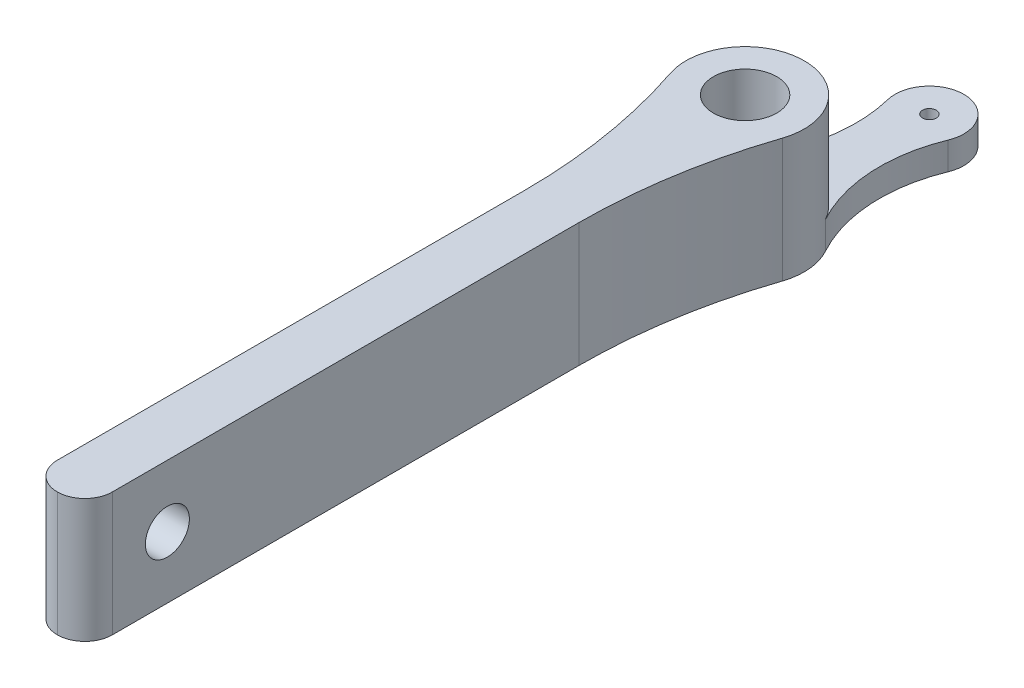
from build123d import *

# Parameters (mm, degrees)
SKETCH1_R           = 14.605
BOSS_EXTRUDE1_DEPTH = 57.15
FILLET1_R           = 254
SKETCH2_R           = 10.16
CUT_EXTRUDE1_DEPTH  = 313.681247479
SKETCH8_R           = 3.175
BOSS_EXTRUDE6_DEPTH = 12.7
SKETCH9_W           = 25.4
SKETCH9_H           = 57.15
BOSS_EXTRUDE7_DEPTH = 12.7
FILLET2_R           = 12.7


with BuildPart() as part:
    # Sketch1 → Boss-Extrude1 (new body)
    with BuildSketch(Plane(origin=(0, 0, 0), x_dir=(1, 0, 0), z_dir=(0, 1, 0))):
        with BuildLine():
            Line((-12.7, -24.171740215), (-12.7, -304.8))
            Line((-12.7, -304.8), (12.7, -304.8))
            Line((12.7, -304.8), (12.7, -24.171740215))
            ThreePointArc((12.7, -24.171740215), (0, 27.305), (-12.7, -24.171740215))
        make_face()
        with Locations(Location((0, 0, 0), (0, 0, 270))):
            Circle(SKETCH1_R, mode=Mode.SUBTRACT)
    extrude(amount=BOSS_EXTRUDE1_DEPTH)

    # Fillet1
    fillet1_edges = [part.edges().sort_by_distance(p)[0] for p in [
        (12.7, 28.575, 24.171740215),
        (-12.7, 28.575, 24.171740215),
    ]]
    fillet(fillet1_edges, radius=FILLET1_R)

    # Sketch2 → Cut-Extrude1 (cut, through all)
    with BuildSketch(Plane.ZY.offset(12.7)):
        with Locations((279.4, 28.575)):
            Circle(SKETCH2_R)
    extrude(amount=-CUT_EXTRUDE1_DEPTH, mode=Mode.SUBTRACT)

    # Sketch8 → Boss-Extrude6 (add)
    with BuildSketch(Plane(origin=(0, 0, 0), x_dir=(1, 0, 0), z_dir=(0, 1, 0))):
        with BuildLine():
            ThreePointArc((20.48678387, 73.276843268), (6.952035658, 95.123295408), (-9.615200393, 75.476830843))
            ThreePointArc((-9.615200393, 75.476830843), (-9.004649416, 44.610856641), (-21.758468792, 16.496425698))
            ThreePointArc((-21.758468792, 16.496425698), (1.990263204, 27.232368193), (23.925719089, 13.157621026))
            ThreePointArc((23.925719089, 13.157621026), (15.395044016, 42.827617971), (20.48678387, 73.276843268))
        make_face()
        with Locations(Location((5.794905888, 79.290523203, 0), (0, 0, 270))):
            Circle(SKETCH8_R, mode=Mode.SUBTRACT)
    extrude(amount=BOSS_EXTRUDE6_DEPTH)

    # Sketch9 → Boss-Extrude7 (add)
    with BuildSketch(Plane.XY.offset(304.8)):
        with Locations((0, 28.575)):
            Rectangle(SKETCH9_W, SKETCH9_H)
    extrude(amount=BOSS_EXTRUDE7_DEPTH)

    # Fillet2
    fillet2_edges = [part.edges().sort_by_distance(p)[0] for p in [
        (-12.7, 28.575, 317.5),
        (12.7, 28.575, 317.5),
    ]]
    fillet(fillet2_edges, radius=FILLET2_R - 0.0001)  # a hair under: the kernel refuses the full size


solid = part.part
